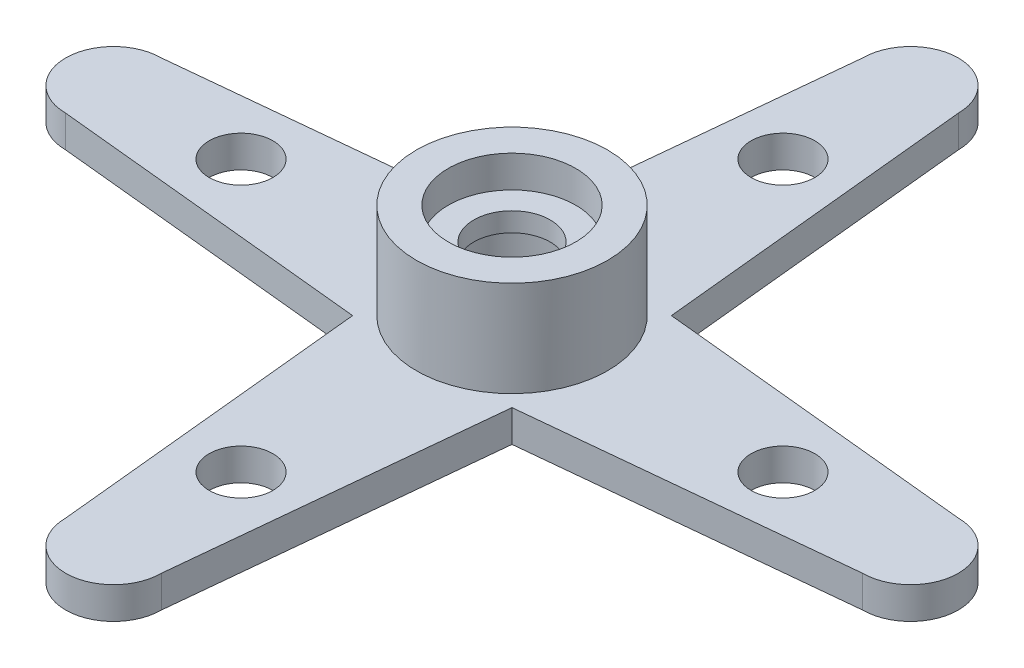
from build123d import *

# Parameters (mm, degrees)
BOSS_EXTRUDE1_START     = -2.5
BOSS_EXTRUDE1_OUTLINE_R = 10
BOSS_EXTRUDE1_DEPTH     = 5
SKETCH2_R               = 15
SKETCH2_R_2             = 10
BOSS_EXTRUDE2_DEPTH     = 15
SKETCH3_R               = 5
CUT_EXTRUDE1_DEPTH      = 101.124921973
BOSS_EXTRUDE3_START     = 9.5
SKETCH4_R               = 10
SKETCH4_R_2             = 6
BOSS_EXTRUDE3_DEPTH     = 3


# Read off the part's stored shape, not the designer's step: Boss-Extrude1
with BuildPart() as part:
    # Boss-Extrude1 outline → Boss-Extrude1 (new body)
    with BuildSketch(Plane(origin=(0, 0, 0), x_dir=(1, 0, 0), z_dir=(0, 1, 0)).offset(BOSS_EXTRUDE1_START)):
        with BuildLine():
            Line((12.5, 12.5), (7.5, 62.5))
            ThreePointArc((7.5, 62.5), (0, 70), (-7.5, 62.5))
            Line((-7.5, 62.5), (-12.5, 12.5))
            Line((-12.5, 12.5), (-62.5, 7.5))
            ThreePointArc((-62.5, 7.5), (-70, 0), (-62.5, -7.5))
            Line((-62.5, -7.5), (-12.5, -12.5))
            Line((-12.5, -12.5), (-7.5, -62.5))
            ThreePointArc((-7.5, -62.5), (0, -70), (7.5, -62.5))
            Line((7.5, -62.5), (12.5, -12.5))
            Line((12.5, -12.5), (62.5, -7.5))
            ThreePointArc((62.5, -7.5), (70, 0), (62.5, 7.5))
            Line((62.5, 7.5), (12.5, 12.5))
        make_face()
        Circle(BOSS_EXTRUDE1_OUTLINE_R, mode=Mode.SUBTRACT)
    extrude(amount=BOSS_EXTRUDE1_DEPTH)

    # Sketch2 → Boss-Extrude2 (add)
    with BuildSketch(Plane(origin=(0, 2.5, 0), x_dir=(1, 0, 0), z_dir=(0, 1, 0))):
        with Locations(Location((0, 0, 0), (0, 0, 90))):
            Circle(SKETCH2_R)
        with Locations(Location((0, 0, 0), (0, 0, 270))):
            Circle(SKETCH2_R_2, mode=Mode.SUBTRACT)
    extrude(amount=BOSS_EXTRUDE2_DEPTH)

    # Sketch3 → Cut-Extrude1 (cut, through all)
    with BuildSketch(Plane(origin=(0, 2.5, 0), x_dir=(1, 0, 0), z_dir=(0, 1, 0))):
        with Locations(Location((42.5, 0, 0), (0, 0, 270))):
            Circle(SKETCH3_R)
        with Locations(Location((-42.5, 0, 0), (0, 0, 270))):
            Circle(SKETCH3_R)
        with Locations(Location((0, 42.5, 0), (0, 0, 270))):
            Circle(SKETCH3_R)
        with Locations(Location((0, -42.5, 0), (0, 0, 90))):
            Circle(SKETCH3_R)
    extrude(amount=-CUT_EXTRUDE1_DEPTH, mode=Mode.SUBTRACT)

    # Sketch4 → Boss-Extrude3 (add)
    with BuildSketch(Plane(origin=(0, 0, 0), x_dir=(1, 0, 0), z_dir=(0, 1, 0)).offset(BOSS_EXTRUDE3_START)):
        with Locations(Location((0, 0, 0), (0, 0, 270))):
            Circle(SKETCH4_R)
        with Locations(Location((0, 0, 0), (0, 0, 270))):
            Circle(SKETCH4_R_2, mode=Mode.SUBTRACT)
    extrude(amount=BOSS_EXTRUDE3_DEPTH)


solid = part.part
